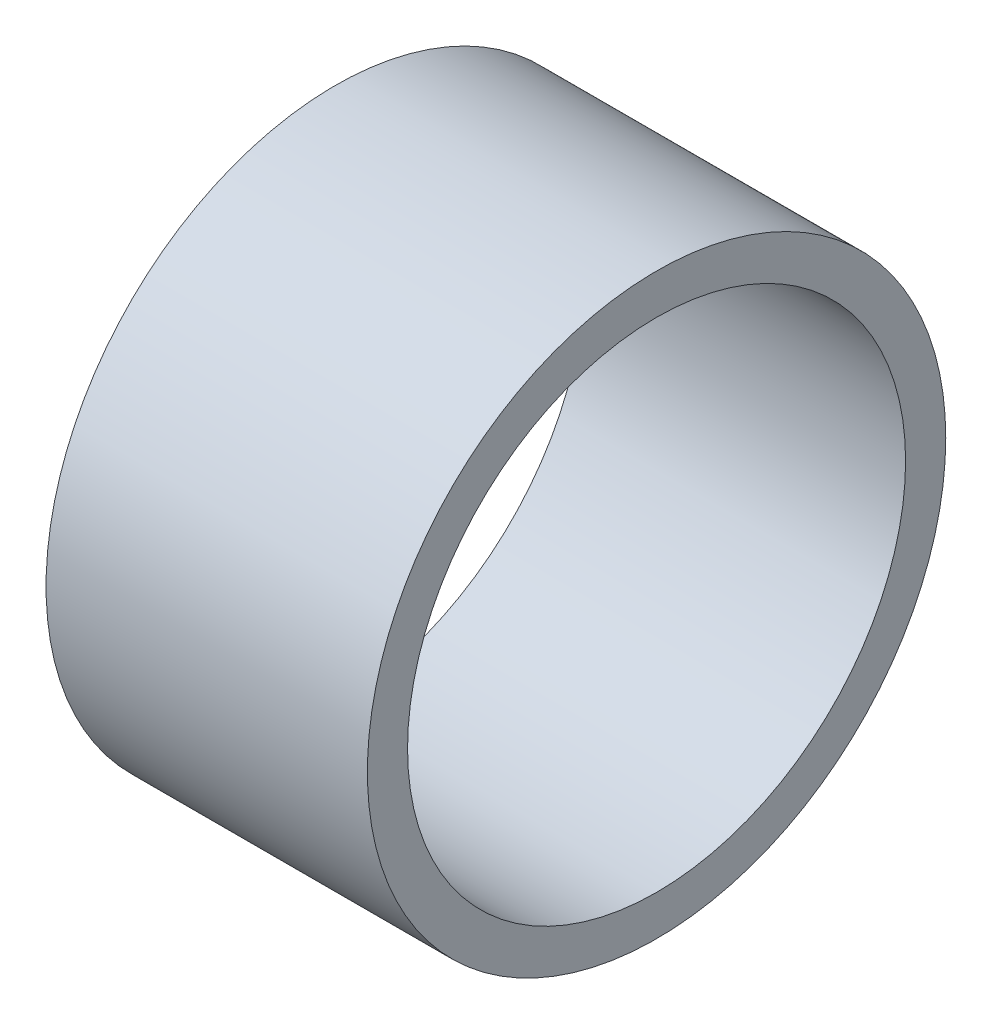
from build123d import *

# Parameters (mm, degrees)
SKETCH1_R           = 22.86
SKETCH1_R_2         = 19.685
BOSS_EXTRUDE1_DEPTH = 12.7


with BuildPart() as part:
    # Sketch1 → Boss-Extrude1 (new, symmetric)
    with BuildSketch(Plane(origin=(0, 0, 0), x_dir=(0, 0, -1), z_dir=(1, 0, 0))):
        Circle(SKETCH1_R)
        Circle(SKETCH1_R_2, mode=Mode.SUBTRACT)
    extrude(amount=BOSS_EXTRUDE1_DEPTH, both=True)


solid = part.part
